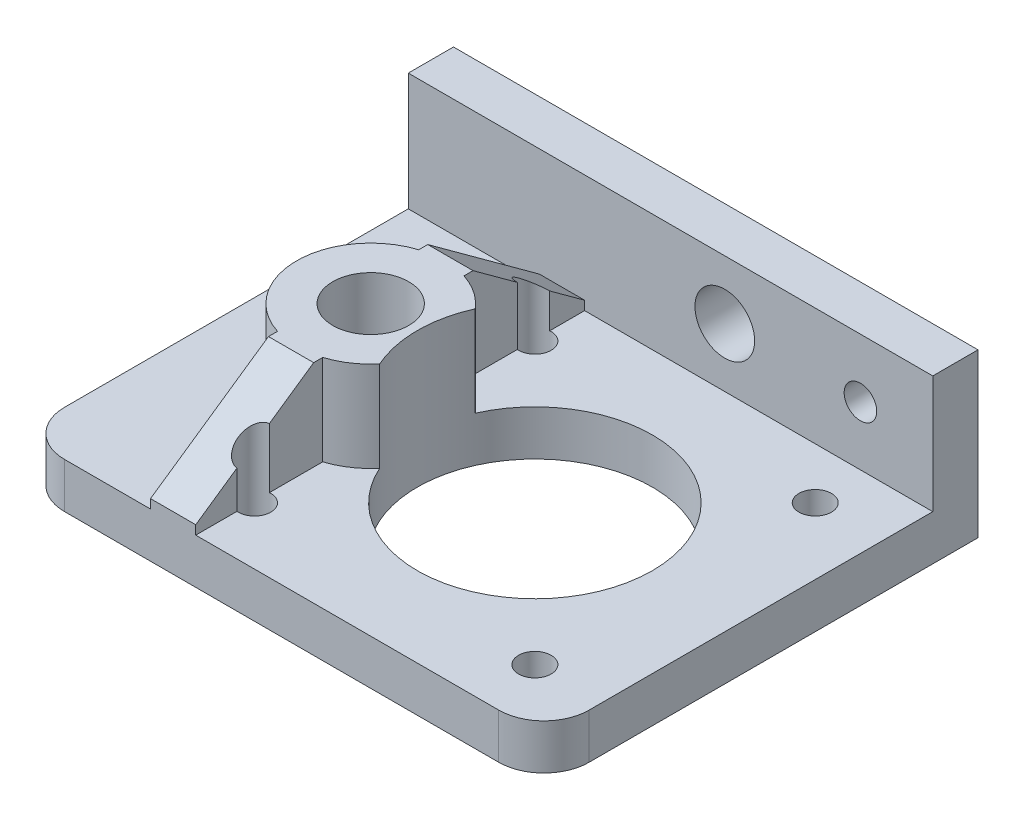
from build123d import *

# Parameters (mm, degrees)
SKETCH1_W               = 58
SKETCH1_H               = 48
SKETCH1_R               = 13
SKETCH1_R_2             = 1.8
BOSS_EXTRUDE1_DEPTH     = 5
BOSS_EXTRUDE2_OUTLINE_R = 4.2
BOSS_EXTRUDE2_DEPTH     = 10
FILLET1_R               = 5
BOSS_EXTRUDE5_DEPTH     = 10
CUT_EXTRUDE2_DEPTH      = 67.492480778
SKETCH7_W               = 58
SKETCH7_H               = 5
BOSS_EXTRUDE6_DEPTH     = 13
SKETCH8_R               = 3.3
SKETCH8_R_2             = 1.8
CUT_EXTRUDE3_DEPTH      = 20


# Read off the part's stored shape, not the designer's step: Boss-Extrude2, Boss-Extrude5
with BuildPart() as part:
    # Sketch1 → Boss-Extrude1 (new body)
    with BuildSketch(Plane(origin=(0, 0, 0), x_dir=(1, 0, 0), z_dir=(0, 1, 0))):
        with Locations((29, -24)):
            Rectangle(SKETCH1_W, SKETCH1_H)
        with Locations(Location((35.15, -26.15, 0), (0, 0, 270))):
            Circle(SKETCH1_R, mode=Mode.SUBTRACT)
        with Locations(Location((19.65, -10.65, 0), (0, 0, 270))):
            Circle(SKETCH1_R_2, mode=Mode.SUBTRACT)
        with Locations(Location((19.65, -41.65, 0), (0, 0, 270))):
            Circle(SKETCH1_R_2, mode=Mode.SUBTRACT)
        with Locations(Location((50.65, -41.65, 0), (0, 0, 270))):
            Circle(SKETCH1_R_2, mode=Mode.SUBTRACT)
        with Locations(Location((50.65, -10.65, 0), (0, 0, 270))):
            Circle(SKETCH1_R_2, mode=Mode.SUBTRACT)
    extrude(amount=BOSS_EXTRUDE1_DEPTH)

    # Boss-Extrude2 outline → Boss-Extrude2 (add)
    with BuildSketch(Plane(origin=(0, 5, 0), x_dir=(1, 0, 0), z_dir=(0, 1, 0))):
        with BuildLine():
            ThreePointArc((23.271694215, -31.432598951), (22.15, -26.15), (23.271694215, -20.867401049))
            ThreePointArc((23.271694215, -20.867401049), (8.8, -26.15), (23.271694215, -31.432598951))
        make_face()
        with Locations((17, -26.15)):
            Circle(BOSS_EXTRUDE2_OUTLINE_R, mode=Mode.SUBTRACT)
    extrude(amount=BOSS_EXTRUDE2_DEPTH)

    # Fillet1
    fillet1_edges = [part.edges().sort_by_distance(p)[0] for p in [
        (58, 2.5, 48),
        (0, 2.5, 48),
    ]]
    fillet(fillet1_edges, radius=FILLET1_R)

    # Boss-Extrude5 outline → Boss-Extrude5 (add)
    with BuildSketch(Plane(origin=(0, 5, 0), x_dir=(1, 0, 0), z_dir=(0, 1, 0))):
        with BuildLine():
            ThreePointArc((19.5, -12.443739111), (17.85, -10.65), (19.5, -8.856260889))
            Line((19.5, -8.856260889), (19.5, -5))
            Line((19.5, -5), (14.5, -5))
            Line((14.5, -5), (14.5, -18.340390535))
            ThreePointArc((14.5, -18.340390535), (17, -17.95), (19.5, -18.340390535))
            Line((19.5, -18.340390535), (19.5, -12.443739111))
        make_face()
        with BuildLine():
            ThreePointArc((19.5, -33.959609465), (17, -34.35), (14.5, -33.959609465))
            Line((14.5, -33.959609465), (14.5, -48))
            Line((14.5, -48), (19.5, -48))
            Line((19.5, -48), (19.5, -43.443739111))
            ThreePointArc((19.5, -43.443739111), (17.85, -41.65), (19.5, -39.856260889))
            Line((19.5, -39.856260889), (19.5, -33.959609465))
        make_face()
    extrude(amount=BOSS_EXTRUDE5_DEPTH)

    # Sketch6 → Cut-Extrude2 (cut, through all)
    with BuildSketch(Plane.ZY.offset(-14.5)):
        Polygon((17.340390535, 15), (5, 6), (5, 15), align=None)
        Polygon((48, 6), (34.959609465, 15), (48, 15), align=None)
    extrude(amount=-CUT_EXTRUDE2_DEPTH, mode=Mode.SUBTRACT)

    # Sketch7 → Boss-Extrude6 (add)
    with BuildSketch(Plane(origin=(0, 5, 0), x_dir=(1, 0, 0), z_dir=(0, 1, 0))):
        with Locations((29, -2.5)):
            Rectangle(SKETCH7_W, SKETCH7_H)
    extrude(amount=BOSS_EXTRUDE6_DEPTH)

    # Sketch8 → Cut-Extrude3 (cut)
    with BuildSketch(Plane.XY.offset(5)):
        with Locations((35, 11.5)):
            Circle(SKETCH8_R)
        with Locations((50, 11.5)):
            Circle(SKETCH8_R_2)
    extrude(amount=-CUT_EXTRUDE3_DEPTH, mode=Mode.SUBTRACT)


solid = part.part
